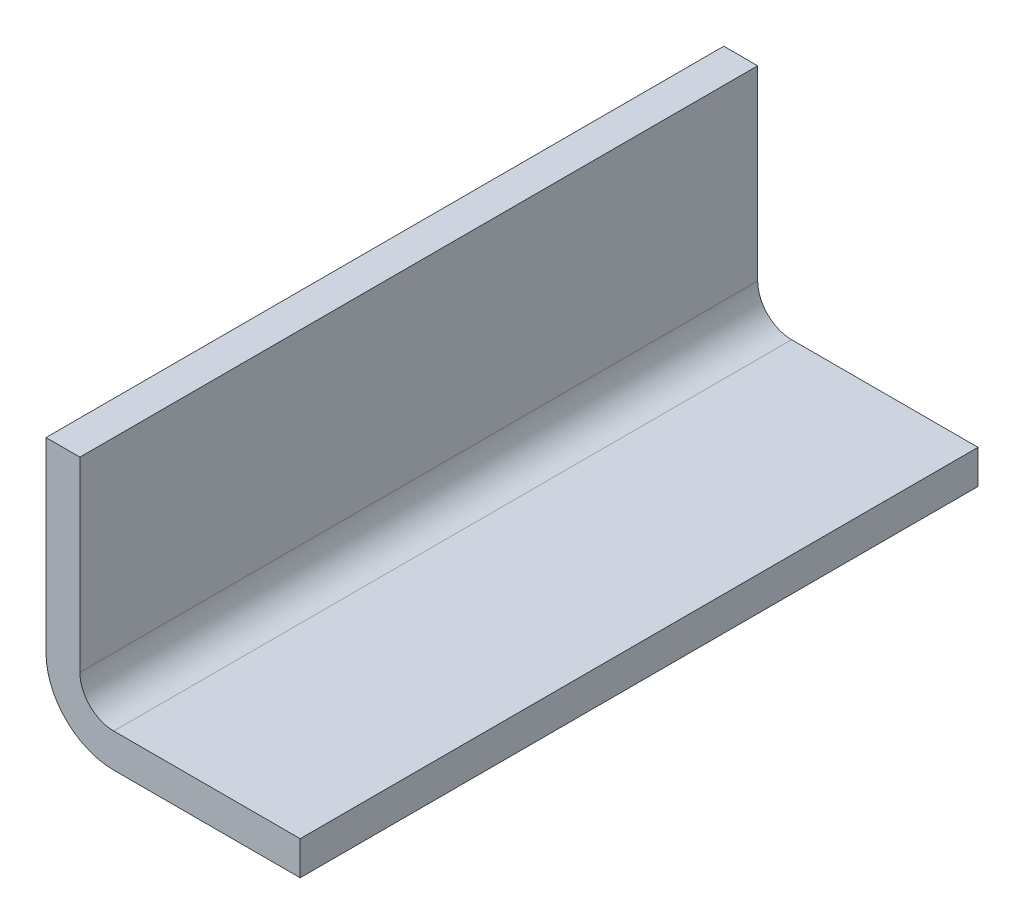
from build123d import *

# Parameters (mm, degrees)
BOSS_EXTRUDE1_DEPTH = 20


with BuildPart() as part:
    # Sketch1 → Boss-Extrude1 (new, symmetric)
    with BuildSketch(Plane.XY):
        with BuildLine():
            Line((0, 4), (0, 15))
            Line((0, 15), (2, 15))
            Line((2, 15), (2, 4))
            ThreePointArc((2, 4), (2.585786438, 2.585786438), (4, 2))
            Line((4, 2), (15, 2))
            Line((15, 2), (15, 0))
            Line((15, 0), (4, 0))
            ThreePointArc((4, 0), (1.171572875, 1.171572875), (0, 4))
        make_face()
    extrude(amount=BOSS_EXTRUDE1_DEPTH, both=True)


solid = part.part
